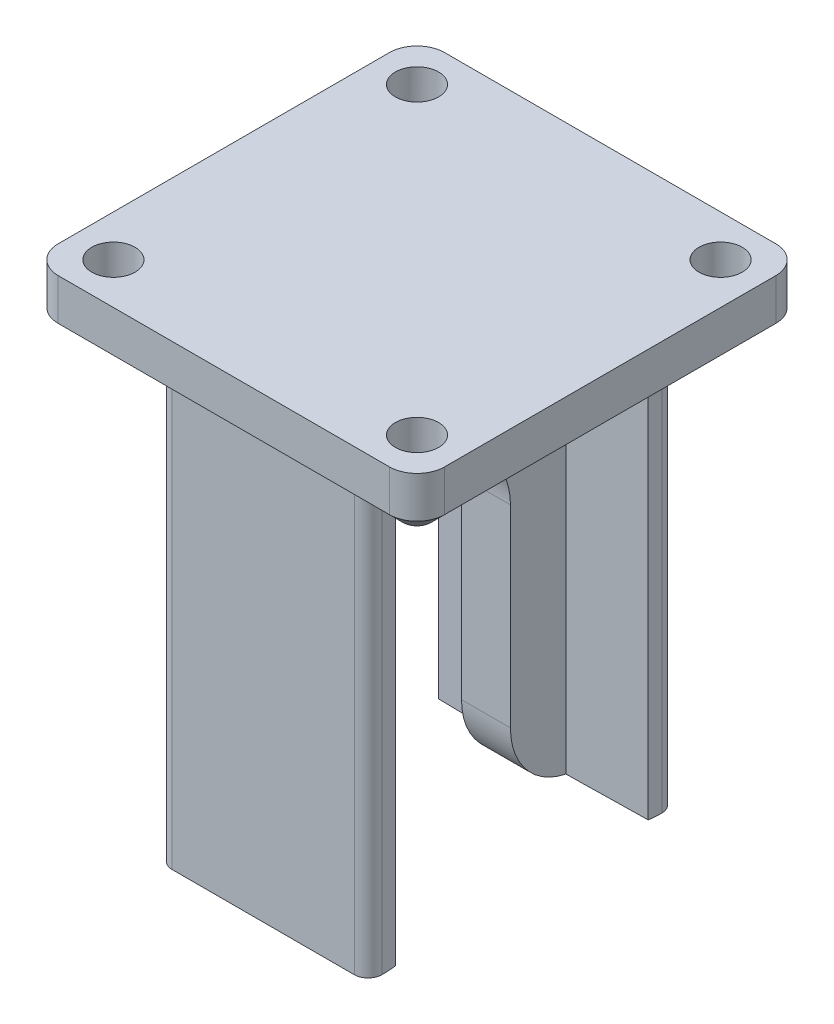
from build123d import *

# Parameters (mm, degrees)
SKETCH1_W           = 44.45
SKETCH1_H           = 44.45
BOSS_EXTRUDE1_DEPTH = 3.175
BOSS_EXTRUDE2_DEPTH = 50.8
FILLET1_R           = 3.175
FILLET2_R           = 1.5875
FILLET3_R           = 3.175
SKETCH4_R           = 2.4892
CUT_EXTRUDE1_DEPTH  = 66.222877505
SKETCH5_W           = 15.875
SKETCH5_H           = 38.1
CUT_EXTRUDE2_DEPTH  = 64.515137759
FILLET4_R           = 7.9375
FILLET5_R           = 7.9375
CHAMFER1_SIZE       = 1.5875


with BuildPart() as part:
    # Sketch1 → Boss-Extrude1 (new, symmetric)
    with BuildSketch(Plane(origin=(0, 0, 0), x_dir=(1, 0, 0), z_dir=(0, 1, 0))):
        Rectangle(SKETCH1_W, SKETCH1_H)
    extrude(amount=BOSS_EXTRUDE1_DEPTH, both=True)

    # Sketch3 → Boss-Extrude2 (add)
    with BuildSketch(Plane.XZ.offset(3.175)):
        Polygon((12.0674, 14.518814274), (2.8134, 14.31134463), (2.8134, -14.31134463), (12.0674, -14.518814274), (12.0674, -17.693814274), (-12.0674, -17.693814274), (-12.0674, -14.518814274), (-2.8134, -14.31134463), (-2.8134, 14.31134463), (-12.0674, 14.518814274), (-12.0674, 17.693814274), (12.0674, 17.693814274), align=None)
    extrude(amount=BOSS_EXTRUDE2_DEPTH)

    # Fillet1
    fillet1_edges = [part.edges().sort_by_distance(p)[0] for p in [
        (22.225, 0, 22.225),
        (-22.225, 0, 22.225),
        (-22.225, 0, -22.225),
        (22.225, 0, -22.225),
    ]]
    fillet(fillet1_edges, radius=FILLET1_R)

    # Fillet2
    fillet2_edges = [part.edges().sort_by_distance(p)[0] for p in [
        (12.0674, -28.575, 17.693814274),
        (-12.0674, -28.575, 17.693814274),
        (-12.0674, -28.575, -17.693814274),
        (12.0674, -28.575, -17.693814274),
    ]]
    fillet(fillet2_edges, radius=FILLET2_R)

    # Fillet3
    fillet3_edges = [part.edges().sort_by_distance(p)[0] for p in [
        (7.4404, -3.175, -14.415079452),
        (2.8134, -3.175, 0),
        (7.4404, -3.175, 14.415079452),
        (-7.4404, -3.175, 14.415079452),
        (-2.8134, -3.175, 0),
        (-7.4404, -3.175, -14.415079452),
    ]]
    fillet(fillet3_edges, radius=FILLET3_R)

    # Sketch4 → Cut-Extrude1 (cut, through all)
    with BuildSketch(Plane(origin=(0, 3.175, 0), x_dir=(1, 0, 0), z_dir=(0, 1, 0))):
        with Locations(Location((17.4625, 17.4625, 0), (0, 0, 270))):
            Circle(SKETCH4_R)
        with Locations(Location((17.4625, -17.4625, 0), (0, 0, 270))):
            Circle(SKETCH4_R)
        with Locations(Location((-17.4625, -17.4625, 0), (0, 0, 270))):
            Circle(SKETCH4_R)
        with Locations(Location((-17.4625, 17.4625, 0), (0, 0, 270))):
            Circle(SKETCH4_R)
    extrude(amount=-CUT_EXTRUDE1_DEPTH, mode=Mode.SUBTRACT)

    # Sketch5 → Cut-Extrude2 (cut, through all)
    with BuildSketch(Plane(origin=(2.8134, 0, 0), x_dir=(0, 0, -1), z_dir=(1, 0, 0))):
        with Locations((0, -34.925)):
            Rectangle(SKETCH5_W, SKETCH5_H)
    extrude(amount=-CUT_EXTRUDE2_DEPTH, mode=Mode.SUBTRACT)

    # Fillet4
    fillet4_edges = [part.edges().sort_by_distance(p)[0] for p in [
        (0, -15.875, -7.9375),
        (0, -15.875, 7.9375),
    ]]
    fillet(fillet4_edges, radius=FILLET4_R - 0.0001)  # a hair under: the kernel refuses the full size

    # Fillet5
    fillet5_edges = [part.edges().sort_by_distance(p)[0] for p in [
        (0, -53.975, -7.9375),
        (0, -53.975, 7.9375),
    ]]
    fillet(fillet5_edges, radius=FILLET5_R)

    # Chamfer1
    chamfer1_edges = [part.edges().sort_by_distance(p)[0] for p in [
        (0, -3.175, -22.225),
        (22.225, -3.175, 0),
        (0, -3.175, 22.225),
        (-22.225, -3.175, 0),
        (21.29506403, -3.175, 21.29506403),
        (-21.29506403, -3.175, 21.29506403),
        (-21.29506403, -3.175, -21.29506403),
        (21.29506403, -3.175, -21.29506403),
    ]]
    chamfer(chamfer1_edges, length=CHAMFER1_SIZE)


solid = part.part
